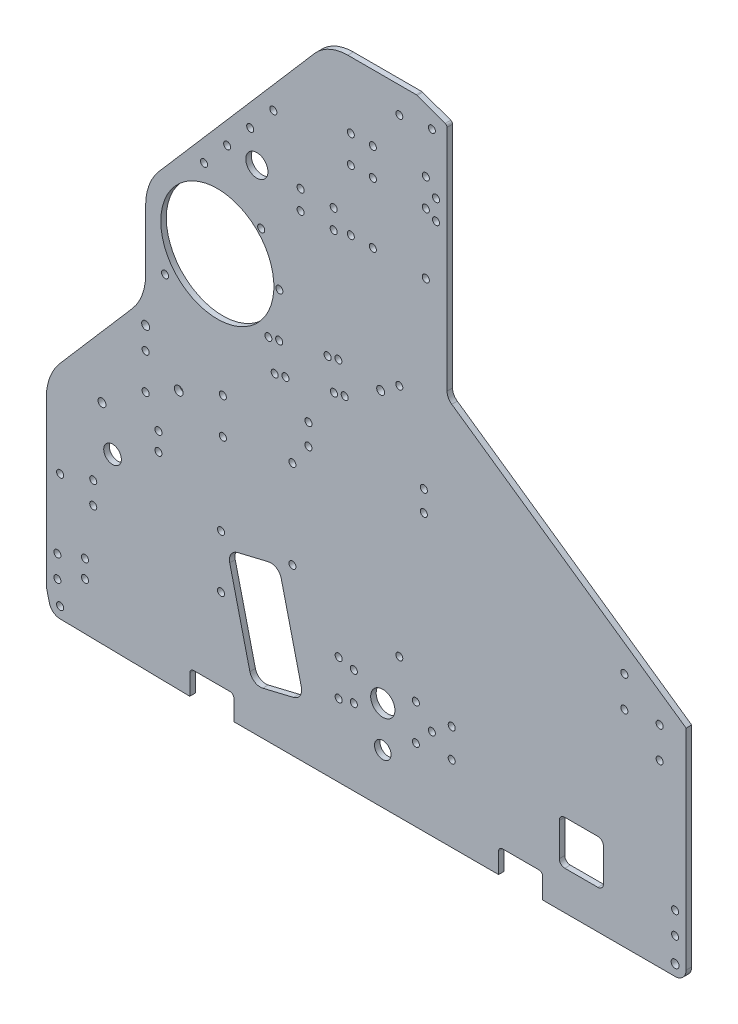
from build123d import *

# Parameters (mm, degrees)
SKETCH1_R           = 2.032
SKETCH1_R_2         = 5.08
SKETCH1_R_3         = 2.54
SKETCH1_R_4         = 2
BOSS_EXTRUDE1_DEPTH = 3.175
FILLET1_R           = 2.286
FILLET2_R           = 6.35
SKETCH2_R           = 2.032
CUT_EXTRUDE1_DEPTH  = 505.524983177
FILLET3_R           = 1.5875
SKETCH3_R           = 2.032
SKETCH3_R_2         = 2.286
CUT_EXTRUDE2_DEPTH  = 505.524983177
SKETCH4_R           = 2.032
SKETCH4_R_2         = 6.985
SKETCH4_R_3         = 4.7625
CUT_EXTRUDE3_DEPTH  = 505.524983177
SKETCH5_R           = 32.54375
SKETCH5_R_2         = 2.286000001
CUT_EXTRUDE5_DEPTH  = 505.524983177
FILLET4_R           = 31.75
CUT_EXTRUDE6_DEPTH  = 505.524983177
FILLET5_R           = 25.4
SKETCH8_R           = 2.032000002
SKETCH8_R_2         = 2.031999999
SKETCH8_R_3         = 2.031999998
CUT_EXTRUDE7_DEPTH  = 505.524983177
SKETCH10_R          = 2.032
CUT_EXTRUDE8_DEPTH  = 505.524983177
FILLET6_R           = 6.35
SKETCH11_RX         = 2.032
SKETCH11_RY         = 2.031999502
CUT_EXTRUDE9_DEPTH  = 505.524983177
SKETCH12_R          = 2.032
CUT_EXTRUDE10_DEPTH = 505.524983319
SKETCH14_R          = 6.375981846
CUT_EXTRUDE11_DEPTH = 505.524983319
SKETCH15_R          = 2.286
CUT_EXTRUDE12_DEPTH = 505.524983319


with BuildPart() as part:
    # Sketch1 → Boss-Extrude1 (new body)
    with BuildSketch(Plane.XY):
        with BuildLine():
            Line((7.829508682, -19.049081656), (82.55, -20.32))
            Line((82.55, -20.32), (82.55, -6.35))
            Line((82.55, -6.35), (107.95, -6.35))
            Line((107.95, -6.35), (107.95, -20.32))
            Line((107.95, -20.32), (260.35, -20.32))
            Line((260.35, -20.32), (260.35, -6.35))
            Line((260.35, -6.35), (285.75, -6.35))
            Line((285.75, -6.35), (285.75, -20.32))
            Line((285.75, -20.32), (368.3, -20.32))
            Line((368.3, -20.32), (368.3, 106.68))
            Line((368.3, 106.68), (230.66375, 202.565))
            Line((230.66375, 202.565), (230.66375, 338.455))
            Line((230.66375, 338.455), (213.19998, 344.805))
            Line((213.19998, 344.805), (203.2, 344.805))
            Line((203.2, 344.805), (161.925, 344.805))
            Line((161.925, 344.805), (52.720122664, 218.469945827))
            ThreePointArc((52.720122664, 218.469945827), (52.803835479, 218.142145922), (52.832, 217.805))
            ThreePointArc((52.832, 217.805), (52.095493096, 216.239521914), (50.419872403, 215.808871996))
            Line((50.419872403, 215.808871996), (0, 157.48))
            Line((0, 157.48), (0, 0))
            Line((0, 0), (0, -6.35))
            ThreePointArc((0, -6.35), (0.047577015, -7.125863724), (0.189595124, -7.890101219))
            Line((0.189595124, -7.890101219), (1.777095124, -14.240101219))
            ThreePointArc((1.777095124, -14.240101219), (3.987212552, -17.671692778), (7.829508682, -19.049081656))
        make_face()
        with Locations((7.9375, -12.7)):
            Circle(SKETCH1_R, mode=Mode.SUBTRACT)
        with Locations((6.35, 0)):
            Circle(SKETCH1_R, mode=Mode.SUBTRACT)
        with Locations((6.35, 12.7)):
            Circle(SKETCH1_R, mode=Mode.SUBTRACT)
        with Locations((38.1, 78.105)):
            Circle(SKETCH1_R_2, mode=Mode.SUBTRACT)
        with Locations((57.15, 118.58625)):
            Circle(SKETCH1_R, mode=Mode.SUBTRACT)
        with Locations((57.15, 139.22375)):
            Circle(SKETCH1_R, mode=Mode.SUBTRACT)
        with Locations((76.2, 128.905)):
            Circle(SKETCH1_R_3, mode=Mode.SUBTRACT)
        with Locations((101.6, 118.58625)):
            Circle(SKETCH1_R, mode=Mode.SUBTRACT)
        with Locations((101.6, 139.22375)):
            Circle(SKETCH1_R, mode=Mode.SUBTRACT)
        with Locations((203.2, 59.805)):
            Circle(SKETCH1_R_4, mode=Mode.SUBTRACT)
        with Locations((361.95, 0)):
            Circle(SKETCH1_R, mode=Mode.SUBTRACT)
        with Locations((361.95, 12.7)):
            Circle(SKETCH1_R, mode=Mode.SUBTRACT)
        with Locations((353.06, 82.955052336)):
            Circle(SKETCH1_R, mode=Mode.SUBTRACT)
        with Locations((332.74, 98.195052336)):
            Circle(SKETCH1_R, mode=Mode.SUBTRACT)
        with Locations((332.74, 115.975052336)):
            Circle(SKETCH1_R, mode=Mode.SUBTRACT)
        with Locations((353.06, 100.735052336)):
            Circle(SKETCH1_R, mode=Mode.SUBTRACT)
        with Locations((68.326, 182.923674932)):
            Circle(SKETCH1_R, mode=Mode.SUBTRACT)
        with Locations((76.2, 217.805)):
            Circle(SKETCH1_R, mode=Mode.SUBTRACT)
        with Locations((90.779500502, 249.682)):
            Circle(SKETCH1_R, mode=Mode.SUBTRACT)
        with Locations((104.067838673, 265.054783374)):
            Circle(SKETCH1_R, mode=Mode.SUBTRACT)
        with Locations((117.356176844, 280.427566748)):
            Circle(SKETCH1_R, mode=Mode.SUBTRACT)
        with Locations((130.644515014, 295.800350122)):
            Circle(SKETCH1_R, mode=Mode.SUBTRACT)
        with Locations((203.2, 194.805)):
            Circle(SKETCH1_R_4, mode=Mode.SUBTRACT)
        with Locations((224.31375, 287.401)):
            Circle(SKETCH1_R, mode=Mode.SUBTRACT)
        with Locations((224.31375, 298.831)):
            Circle(SKETCH1_R, mode=Mode.SUBTRACT)
        with Locations((203.2, 329.805)):
            Circle(SKETCH1_R_4, mode=Mode.SUBTRACT)
        with Locations((221.931865, 332.105)):
            Circle(SKETCH1_R_4, mode=Mode.SUBTRACT)
    extrude(amount=BOSS_EXTRUDE1_DEPTH)

    # Fillet1
    fillet1_edges = [part.edges().sort_by_distance(p)[0] for p in [
        (285.75, -6.35, 1.5875),
        (107.95, -6.35, 1.5875),
        (260.35, -6.35, 1.5875),
        (82.55, -6.35, 1.5875),
    ]]
    fillet(fillet1_edges, radius=FILLET1_R)

    # Fillet2
    fillet2_edges = [part.edges().sort_by_distance(p)[0] for p in [
        (230.66375, 202.565, 1.5875),
    ]]
    fillet(fillet2_edges, radius=FILLET2_R)

    # Sketch2 → Cut-Extrude1 (cut, through all)
    with BuildSketch(Plane(origin=(0, 0, 0), x_dir=(-1, 0, 0), z_dir=(0, 0, -1))):
        with Locations((-100.552770272, 71.086035298)):
            Circle(SKETCH2_R)
        with Locations((-100.552770272, 40.606035298)):
            Circle(SKETCH2_R)
        with Locations((-22.225, 18.202541089)):
            Circle(SKETCH2_R)
        with Locations((-22.225, 8.042541089)):
            Circle(SKETCH2_R)
    extrude(amount=-CUT_EXTRUDE1_DEPTH, mode=Mode.SUBTRACT)

    # Fillet3
    fillet3_edges = [part.edges().sort_by_distance(p)[0] for p in [
        (230.66375, 338.455, 1.5875),
        (213.19998, 344.805, 1.5875),
    ]]
    fillet(fillet3_edges, radius=FILLET3_R)

    # Sketch3 → Cut-Extrude2 (cut, through all)
    with BuildSketch(Plane.XY.offset(3.175)):
        with BuildLine():
            Line((127.789350211, 69.359774106), (110.090750339, 65.117184968))
            ThreePointArc((110.090750339, 65.117184968), (106.287939856, 62.356288953), (105.55119507, 57.715047577))
            Line((105.55119507, 57.715047577), (117.160037875, 9.287010566))
            ThreePointArc((117.160037875, 9.287010566), (119.92093389, 5.484200083), (124.562175266, 4.747455297))
            Line((124.562175266, 4.747455297), (142.260775137, 8.990044434))
            ThreePointArc((142.260775137, 8.990044434), (146.063585621, 11.75094045), (146.800330407, 16.392181825))
            Line((146.800330407, 16.392181825), (135.191487602, 64.820218836))
            ThreePointArc((135.191487602, 64.820218836), (132.430591586, 68.62302932), (127.789350211, 69.359774106))
        make_face()
        with Locations((26.987500002, 46.953113935)):
            Circle(SKETCH3_R)
        with Locations((26.987500002, 59.653113935)):
            Circle(SKETCH3_R)
        with Locations((7.937500002, 53.303113935)):
            Circle(SKETCH3_R)
        with Locations((32.030600738, 100.810868776)):
            Circle(SKETCH3_R_2)
        with Locations((64.525942114, 102.94048958)):
            Circle(SKETCH3_R)
        with Locations((64.525942114, 92.525786339)):
            Circle(SKETCH3_R)
        with Locations((134.14375, 208.228121768)):
            Circle(SKETCH3_R)
        with Locations((123.681970341, 233.485092108)):
            Circle(SKETCH3_R)
    extrude(amount=-CUT_EXTRUDE2_DEPTH, mode=Mode.SUBTRACT)

    # Sketch4 → Cut-Extrude3 (cut, through all)
    with BuildSketch(Plane.XY.offset(3.175)):
        with Locations((168.275, 42.06875)):
            Circle(SKETCH4_R)
        with Locations((212.725, 42.06875)):
            Circle(SKETCH4_R)
        with Locations((212.725, 21.43125)):
            Circle(SKETCH4_R)
        with Locations((168.275, 21.43125)):
            Circle(SKETCH4_R)
        with Locations((193.675, 31.75)):
            Circle(SKETCH4_R_2)
        with Locations((177.00498, 40.0431)):
            Circle(SKETCH4_R)
        with Locations((177.00498, 23.4569)):
            Circle(SKETCH4_R)
        with Locations((193.675, 8.466666658)):
            Circle(SKETCH4_R_3)
        with Locations((221.931865, 31.75)):
            Circle(SKETCH4_R)
        with Locations((233.36123, 23.4569)):
            Circle(SKETCH4_R)
        with Locations((233.36123, 40.0431)):
            Circle(SKETCH4_R)
    extrude(amount=-CUT_EXTRUDE3_DEPTH, mode=Mode.SUBTRACT)

    # Sketch5 → Cut-Extrude5 (cut, through all)
    with BuildSketch(Plane(origin=(0, 0, 0), x_dir=(-1, 0, 0), z_dir=(0, 0, -1))):
        Polygon((0, 157.48), (-57.15, 223.594705882), (-57.15, 165.333696112), (0, 99.218990229), align=None)
        with Locations((-98.425, 208.228121768)):
            Circle(SKETCH5_R)
        with Locations((-361.95, -13.97)):
            Circle(SKETCH5_R_2)
    extrude(amount=-CUT_EXTRUDE5_DEPTH, mode=Mode.SUBTRACT)

    # Fillet4
    fillet4_edges = [part.edges().sort_by_distance(p)[0] for p in [
        (0, 99.218990229, 1.5875),
        (57.15, 165.333696112, 1.5875),
        (57.15, 223.594705882, 1.5875),
    ]]
    fillet(fillet4_edges, radius=FILLET4_R)

    # Sketch6 → Cut-Extrude6 (cut, through all)
    with BuildSketch(Plane.XY.offset(3.175)):
        with BuildLine():
            Line((298.45, 27.305), (317.5, 27.305))
            ThreePointArc((317.5, 27.305), (319.74506403, 26.37506403), (320.675, 24.13))
            Line((320.675, 24.13), (320.675, 5.08))
            ThreePointArc((320.675, 5.08), (319.74506403, 2.83493597), (317.5, 1.905))
            Line((317.5, 1.905), (298.45, 1.905))
            ThreePointArc((298.45, 1.905), (296.20493597, 2.83493597), (295.275, 5.08))
            Line((295.275, 5.08), (295.275, 24.13))
            ThreePointArc((295.275, 24.13), (296.20493597, 26.37506403), (298.45, 27.305))
        make_face()
    extrude(amount=-CUT_EXTRUDE6_DEPTH, mode=Mode.SUBTRACT)

    # Fillet5
    fillet5_edges = [part.edges().sort_by_distance(p)[0] for p in [
        (161.925, 344.805, 1.5875),
    ]]
    fillet(fillet5_edges, radius=FILLET5_R)

    # Sketch8 → Cut-Extrude7 (cut, through all)
    with BuildSketch(Plane(origin=(0, 0, 0), x_dir=(-1, 0, 0), z_dir=(0, 0, -1))):
        with Locations((-218.44, 290.83)):
            Circle(SKETCH8_R)
        with Locations((-187.96, 290.83)):
            Circle(SKETCH8_R)
        with Locations((-187.96, 306.70500001)):
            Circle(SKETCH8_R_2)
        with Locations((-175.26, 290.83)):
            Circle(SKETCH8_R)
        with Locations((-187.96, 255.905)):
            Circle(SKETCH8_R)
        with Locations((-218.44, 306.70500001)):
            Circle(SKETCH8_R_3)
        with Locations((-175.26, 306.70500001)):
            Circle(SKETCH8_R_2)
        with Locations((-175.26, 255.905)):
            Circle(SKETCH8_R)
        with Locations((-218.44, 255.905)):
            Circle(SKETCH8_R)
    extrude(amount=-CUT_EXTRUDE7_DEPTH, mode=Mode.SUBTRACT)

    # Sketch10 → Cut-Extrude8 (cut, through all)
    with BuildSketch(Plane.XY.offset(3.175)):
        with Locations((141.64248, 74.684371768)):
            Circle(SKETCH10_R)
        with Locations((141.64248, 125.484371768)):
            Circle(SKETCH10_R)
    extrude(amount=-CUT_EXTRUDE8_DEPTH, mode=Mode.SUBTRACT)

    # Fillet6
    fillet6_edges = [part.edges().sort_by_distance(p)[0] for p in [
        (368.3, -20.32, 1.5875),
    ]]
    fillet(fillet6_edges, radius=FILLET6_R)

    # Sketch11 → Cut-Extrude9 (cut, through all)
    with BuildSketch(Plane.XY.offset(3.175)):
        with Locations(Location((150.881424454, 138.43), (0, 0, 90))):
            Ellipse(SKETCH11_RX, SKETCH11_RY)
        with Locations(Location((150.881424454, 150.495), (0, 0, 90))):
            Ellipse(SKETCH11_RX, SKETCH11_RY)
        with Locations(Location((217.30240818, 150.495), (0, 0, 90))):
            Ellipse(SKETCH11_RX, SKETCH11_RY)
        with Locations(Location((217.30240818, 138.43), (0, 0, 90))):
            Ellipse(SKETCH11_RX, SKETCH11_RY)
    extrude(amount=-CUT_EXTRUDE9_DEPTH, mode=Mode.SUBTRACT)

    # Sketch12 → Cut-Extrude10 (cut, through all)
    with BuildSketch(Plane(origin=(0, 0, 0), x_dir=(-1, 0, 0), z_dir=(0, 0, -1))):
        with Locations((-165.4175, 264.63498)):
            Circle(SKETCH12_R)
        with Locations((-165.4175, 253.52248)):
            Circle(SKETCH12_R)
        with Locations((-146.3675, 253.52248)):
            Circle(SKETCH12_R)
        with Locations((-146.3675, 264.63498)):
            Circle(SKETCH12_R)
    extrude(amount=-CUT_EXTRUDE10_DEPTH, mode=Mode.SUBTRACT)

    # Sketch14 → Cut-Extrude11 (cut, through all)
    with BuildSketch(Plane(origin=(0, 0, 0), x_dir=(-1, 0, 0), z_dir=(0, 0, -1))):
        with Locations((-121.184716432, 263.688494682)):
            Circle(SKETCH14_R)
    extrude(amount=-CUT_EXTRUDE11_DEPTH, mode=Mode.SUBTRACT)

    # Sketch15 → Cut-Extrude12 (cut, through all)
    with BuildSketch(Plane.XY.offset(3.175)):
        with Locations((57.15, 151.92375)):
            Circle(SKETCH15_R)
        with Locations((192.439038956, 187.119947783)):
            Circle(SKETCH15_R)
        with BuildLine():
            ThreePointArc((163.873739892, 173.680575348), (163.573171662, 172.102507308), (164.512499361, 170.799317578))
            ThreePointArc((164.512499361, 170.799317578), (167.540838635, 172.982117899), (163.873739892, 173.680575348))
        make_face()
        with BuildLine():
            ThreePointArc((173.43975005, 172.778441408), (173.74031828, 174.356509448), (172.800990581, 175.659699178))
            ThreePointArc((172.800990581, 175.659699178), (169.772651307, 173.476898857), (173.43975005, 172.778441408))
        make_face()
        with BuildLine():
            ThreePointArc((169.158852977, 192.088320238), (166.130513703, 189.905519916), (169.797612447, 189.207062467))
            ThreePointArc((169.797612447, 189.207062467), (170.098180676, 190.785130507), (169.158852977, 192.088320238))
        make_face()
        with BuildLine():
            ThreePointArc((160.231602288, 190.109196408), (159.931034058, 188.531128368), (160.870361757, 187.227938638))
            ThreePointArc((160.870361757, 187.227938638), (163.898701031, 189.410738959), (160.231602288, 190.109196408))
        make_face()
        with BuildLine():
            ThreePointArc((129.776601842, 166.121421831), (129.476033612, 164.543353791), (130.415361311, 163.240164061))
            ThreePointArc((130.415361311, 163.240164061), (133.443700585, 165.422964382), (129.776601842, 166.121421831))
        make_face()
        with BuildLine():
            ThreePointArc((139.342612001, 165.219287891), (139.64318023, 166.797355931), (138.703852531, 168.100545661))
            ThreePointArc((138.703852531, 168.100545661), (135.675513257, 165.91774534), (139.342612001, 165.219287891))
        make_face()
        with BuildLine():
            ThreePointArc((135.700474397, 181.647908951), (136.001042627, 183.225976991), (135.061714928, 184.529166721))
            ThreePointArc((135.061714928, 184.529166721), (132.033375654, 182.3463664), (135.700474397, 181.647908951))
        make_face()
        with BuildLine():
            ThreePointArc((126.134464239, 182.550042891), (125.833896009, 180.971974851), (126.773223708, 179.668785121))
            ThreePointArc((126.773223708, 179.668785121), (129.801562982, 181.851585442), (126.134464239, 182.550042891))
        make_face()
    extrude(amount=-CUT_EXTRUDE12_DEPTH, mode=Mode.SUBTRACT)


solid = part.part
